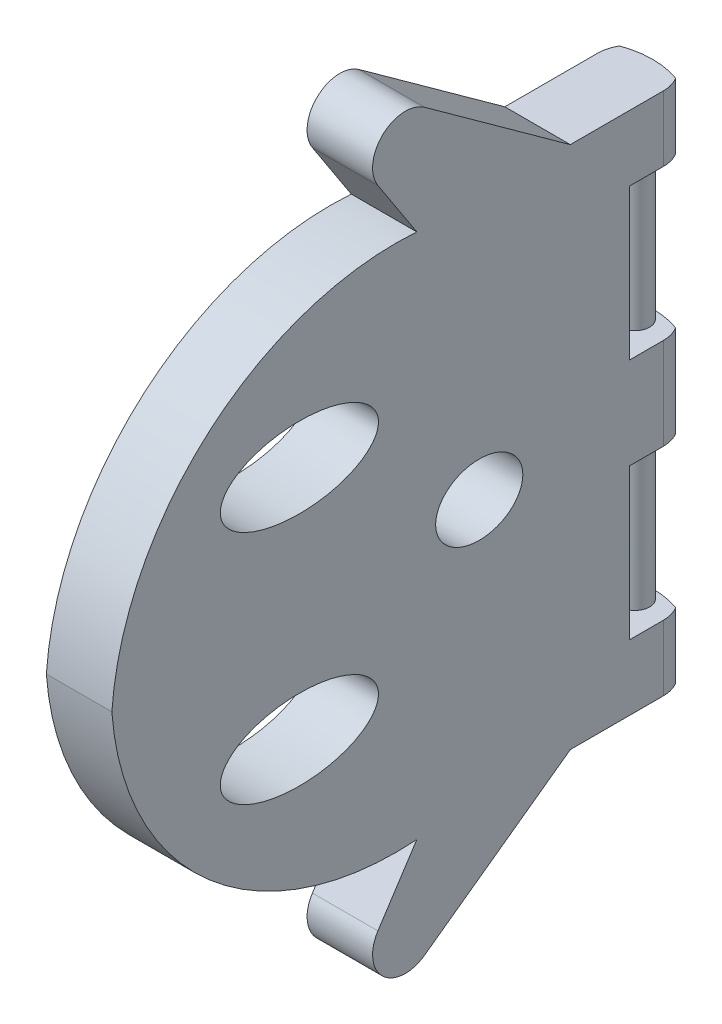
from build123d import *

# Parameters (mm, degrees)
CROQUIS1_RX                = 6.036526162
CROQUIS1_RY                = 3.070539463
CROQUIS1_RX_2              = 3.326417752
CROQUIS1_RY_2              = 2.687947262
SALIENTE_EXTRUIR2_DEPTH    = 5
CROQUIS7_W                 = 42.690533415
CROQUIS7_H                 = 0.890099334
CORTAR_EXTRUIR1_DEPTH      = 10
REDONDEO1_R                = 2.5
CROQUIS3_R                 = 1.1
SALIENTE_EXTRUIR3_DEPTH    = 11.5
SALIENTE_EXTRUIR4_START    = 11.5
CROQUIS6_R                 = 1.1
SALIENTE_EXTRUIR4_DEPTH    = 11.5
CORTAR_EXTRUIR2_DEPTH      = 61.024571756
CORTAR_EXTRUIR2_DEPTH_BACK = 61.024571756


with BuildPart() as part:
    # Croquis1 → Saliente-Extruir2 (new body)
    with BuildSketch(Plane.YZ):
        with BuildLine():
            Line((20.084653921, 11.717525193), (24.641633022, 14.68917463))
            ThreePointArc((24.641633022, 14.68917463), (27.816291871, 14.320547257), (28.034373421, 11.132007562))
            Line((28.034373421, 11.132007562), (20, 0))
            Line((20, 0), (20, -10))
            Line((20, -10), (15, -10))
            Line((15, -10), (15, -4.5))
            Line((15, -4.5), (3.5, -4.5))
            Line((3.5, -4.5), (3.5, -10))
            Line((3.5, -10), (-3.5, -10))
            Line((-3.5, -10), (-3.5, -4.5))
            Line((-3.5, -4.5), (-15, -4.5))
            Line((-15, -4.5), (-15, -10))
            Line((-15, -10), (-20, -10))
            Line((-20, -10), (-20, 0))
            Line((-20, 0), (-28.034373421, 11.132007562))
            ThreePointArc((-28.034373421, 11.132007562), (-27.816291871, 14.320547257), (-24.641633022, 14.68917463))
            Line((-24.641633022, 14.68917463), (-20.084653921, 11.717525193))
            ThreePointArc((-20.084653921, 11.717525193), (-14.865648019, 27.519606107), (0, 35))
            ThreePointArc((0, 35), (14.865648019, 27.519606107), (20.084653921, 11.717525193))
        make_face()
        with Locations(Location((-8.99716125, 20.68522558), (0, 0, 90))):
            Ellipse(CROQUIS1_RX, CROQUIS1_RY, mode=Mode.SUBTRACT)
        with Locations(Location((0, 6.95309076), (0, 0, -90))):
            Ellipse(CROQUIS1_RX_2, CROQUIS1_RY_2, mode=Mode.SUBTRACT)
        with Locations(Location((8.99716125, 20.68522558), (0, 0, 90))):
            Ellipse(CROQUIS1_RX, CROQUIS1_RY, mode=Mode.SUBTRACT)
    extrude(amount=SALIENTE_EXTRUIR2_DEPTH)

    # Croquis7 → Cortar-Extruir1 (cut)
    with BuildSketch(Plane.YZ):
        with Locations((-0.646243402, -10.047083115)):
            Rectangle(CROQUIS7_W, CROQUIS7_H)
    extrude(amount=CORTAR_EXTRUIR1_DEPTH, mode=Mode.SUBTRACT)

    # Redondeo1
    redondeo1_edges = [part.edges().sort_by_distance(p)[0] for p in [
        (0, 17.5, -9.602033448),
        (5, 17.5, -9.602033448),
        (0, 0, -9.602033448),
        (5, 0, -9.602033448),
        (0, -17.5, -9.602033448),
        (5, -17.5, -9.602033448),
    ]]
    fillet(redondeo1_edges, radius=REDONDEO1_R - 0.0001)  # a hair under: the kernel refuses the full size

    # Croquis3 → Saliente-Extruir3 (add)
    with BuildSketch(Plane(origin=(0, 3.5, 0), x_dir=(-1, 0, 0), z_dir=(0, 1, 0))):
        with Locations(Location((-2.5, -7.45, 0), (0, 0, 270))):
            Circle(CROQUIS3_R)
    extrude(amount=SALIENTE_EXTRUIR3_DEPTH)

    # Croquis6 → Saliente-Extruir4 (add)
    with BuildSketch(Plane.XZ.offset(3.5).offset(SALIENTE_EXTRUIR4_START)):
        with Locations(Location((2.5, -7.45, 0), (0, 0, 270))):
            Circle(CROQUIS6_R)
    extrude(amount=-SALIENTE_EXTRUIR4_DEPTH)

    # Croquis8 → Cortar-Extruir2 (cut, two sides: drawn at the far end of the back side and taken through both)
    with BuildSketch(Plane(origin=(0, 20, 0), x_dir=(-1, 0, 0), z_dir=(0, 1, 0)).offset(-CORTAR_EXTRUIR2_DEPTH_BACK)):
        with BuildLine():
            Line((-74.782541857, 59.609037795), (-6.886174559, -6.99410531))
            ThreePointArc((-6.886174559, -6.99410531), (-2.511263824, -8.781661023), (1.863646912, -6.99410531))
            Line((1.863646912, -6.99410531), (69.76001421, 59.609037795))
            Line((69.76001421, 59.609037795), (69.76001421, -130.610786238))
            Line((69.76001421, -130.610786238), (-74.782541857, -130.610786238))
            Line((-74.782541857, -130.610786238), (-74.782541857, 59.609037795))
        make_face()
    extrude(amount=CORTAR_EXTRUIR2_DEPTH + CORTAR_EXTRUIR2_DEPTH_BACK, mode=Mode.SUBTRACT)


solid = part.part
